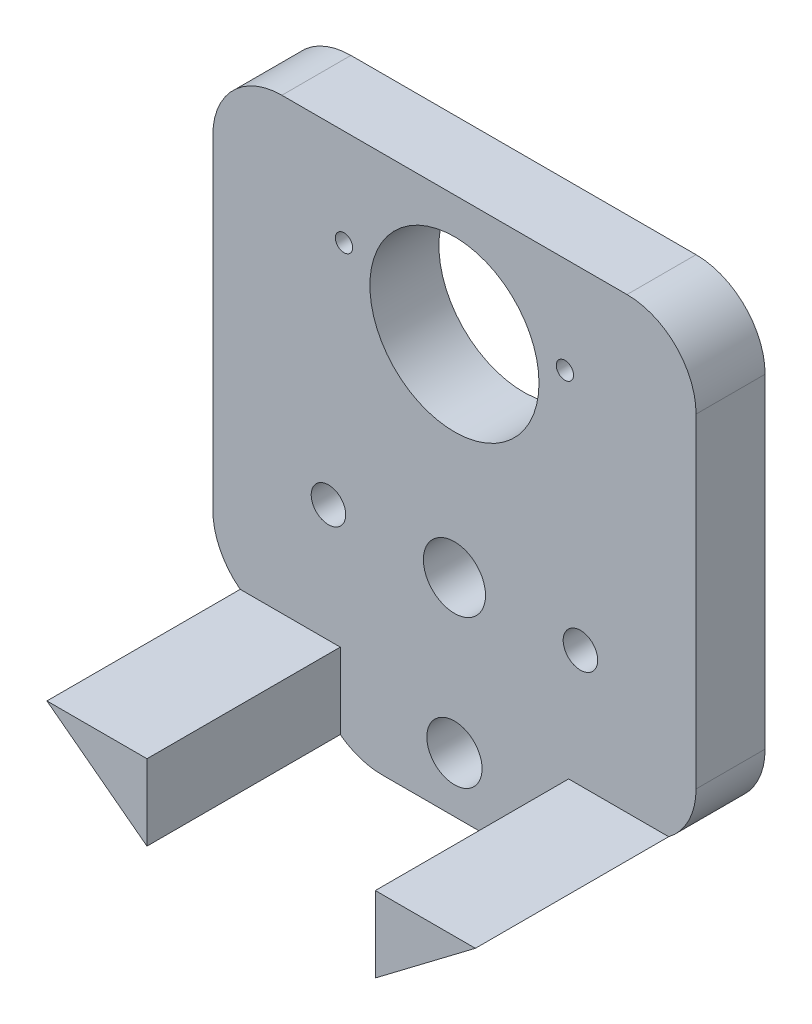
from build123d import *

# Parameters (mm, degrees)
BOSS_EXTRUDE1_DEPTH = 10
SKETCH2_R           = 4
SKETCH2_R_2         = 4.5
SKETCH2_R_3         = 2.5
CUT_EXTRUDE1_DEPTH  = 54.347914673
SKETCH8_R           = 12.25
CUT_EXTRUDE9_DEPTH  = 10
FILLET1_R           = 10
BOSS_EXTRUDE2_DEPTH = 28
SKETCH11_R          = 1.25
CUT_EXTRUDE10_DEPTH = 10


with BuildPart() as part:
    # Sketch1 → Boss-Extrude1 (new body)
    with BuildSketch(Plane.XY):
        Polygon((-35, 39), (35, 39), (35, -23), (13.861088822, -39), (-13.861088822, -39), (-35, -23), align=None)
    extrude(amount=BOSS_EXTRUDE1_DEPTH)

    # Sketch2 → Cut-Extrude1 (cut, through all)
    with BuildSketch(Plane.XY.offset(10)):
        with Locations((0, -31)):
            Circle(SKETCH2_R)
        with Locations((0, -9)):
            Circle(SKETCH2_R_2)
        with Locations((-18.25, -9)):
            Circle(SKETCH2_R_3)
        with Locations((18.25, -9)):
            Circle(SKETCH2_R_3)
    extrude(amount=-CUT_EXTRUDE1_DEPTH, mode=Mode.SUBTRACT)

    # Sketch8 → Cut-Extrude9 (cut)
    with BuildSketch(Plane.XY.offset(10)):
        with Locations((0, 21.51390675)):
            Circle(SKETCH8_R)
    extrude(amount=-CUT_EXTRUDE9_DEPTH, mode=Mode.SUBTRACT)

    # Fillet1
    fillet1_edges = [part.edges().sort_by_distance(p)[0] for p in [
        (35, 39, 5),
        (-35, 39, 5),
        (35, -23, 5),
        (13.861088822, -39, 5),
        (-13.861088822, -39, 5),
        (-35, -23, 5),
    ]]
    fillet(fillet1_edges, radius=FILLET1_R)

    # Sketch10 → Boss-Extrude2 (add)
    with BuildSketch(Plane.XY.offset(10)):
        Polygon((-31.035142881, -26.0009925), (-16.538435196, -36.973521832), (-16.538435196, -26.0009925), align=None)
    boss_extrude2 = extrude(amount=BOSS_EXTRUDE2_DEPTH)

    # Mirror1: Boss-Extrude2 across plane
    add(boss_extrude2.mirror(Plane(origin=(0, 0, 0), x_dir=(0, 0, 1), z_dir=(1, 0, 0))))

    # Sketch11 → Cut-Extrude10 (cut)
    with BuildSketch(Plane.XY.offset(10)):
        with Locations((-16, 25)):
            Circle(SKETCH11_R)
        with Locations((16, 25)):
            Circle(SKETCH11_R)
    extrude(amount=-CUT_EXTRUDE10_DEPTH, mode=Mode.SUBTRACT)


solid = part.part
